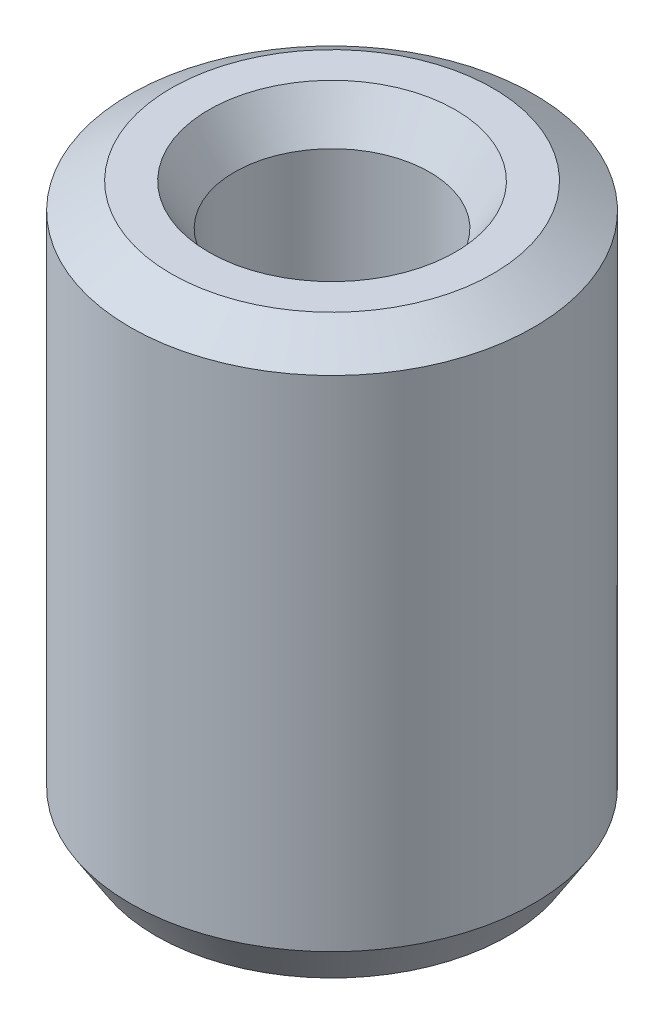
from build123d import *
from OCP.BRepFilletAPI import BRepFilletAPI_MakeChamfer

# Parameters (mm, degrees)
SKETCH1_R           = 5
BOSS_EXTRUDE1_DEPTH = 14.014862724
SKETCH2_R           = 2.415767301
CUT_EXTRUDE1_DEPTH  = 16.697655149
CHAMFER1_SIZE       = 0.638908955
CHAMFER1_SIZE2      = 1.016032577


with BuildPart() as part:
    # Sketch1 → Boss-Extrude1 (new body)
    with BuildSketch(Plane(origin=(0, 0, 0), x_dir=(1, 0, 0), z_dir=(0, 1, 0))):
        Circle(SKETCH1_R)
    extrude(amount=BOSS_EXTRUDE1_DEPTH)

    # Sketch2 → Cut-Extrude1 (cut, through all)
    with BuildSketch(Plane(origin=(0, 0, 0), x_dir=(1, 0, 0), z_dir=(0, 1, 0))):
        Circle(SKETCH2_R)
    extrude(amount=CUT_EXTRUDE1_DEPTH, mode=Mode.SUBTRACT)

    # Chamfer1: one chamfer whose edges measure the first distance from different faces: ONE call of the kernel's chamfer builder (chamfer() names one face for all edges)
    chamfer1_edges_1 = [part.edges().sort_by_distance(p)[0] for p in [
        (-2.415767301, 14.014862724, 0),
    ]]
    chamfer1_side_1 = [part.faces().sort_by_distance(p)[0] for p in [
        (-4.858578644, 14.014862724, 0),
    ]]
    chamfer1_edges_2 = [part.edges().sort_by_distance(p)[0] for p in [
        (-2.415767301, 0, 0),
    ]]
    chamfer1_side_2 = [part.faces().sort_by_distance(p)[0] for p in [
        (-2.415767301, 7.007431362, 0),
    ]]
    chamfer1_edges_3 = [part.edges().sort_by_distance(p)[0] for p in [
        (-5, 0, 0),
    ]]
    chamfer1_side_3 = [part.faces().sort_by_distance(p)[0] for p in [
        (-4.858578644, 0, 0),
    ]]
    chamfer1_edges_4 = [part.edges().sort_by_distance(p)[0] for p in [
        (-5, 14.014862724, 0),
    ]]
    chamfer1_side_4 = [part.faces().sort_by_distance(p)[0] for p in [
        (-5, 7.007431362, 0),
    ]]
    chamfer1 = BRepFilletAPI_MakeChamfer(part.part.solid().wrapped)
    for e in chamfer1_edges_1:
        chamfer1.Add(CHAMFER1_SIZE, CHAMFER1_SIZE2, e.wrapped, chamfer1_side_1[0].wrapped)  # the first distance lies on this face
    for e in chamfer1_edges_2:
        chamfer1.Add(CHAMFER1_SIZE, CHAMFER1_SIZE2, e.wrapped, chamfer1_side_2[0].wrapped)  # the first distance lies on this face
    for e in chamfer1_edges_3:
        chamfer1.Add(CHAMFER1_SIZE, CHAMFER1_SIZE2, e.wrapped, chamfer1_side_3[0].wrapped)  # the first distance lies on this face
    for e in chamfer1_edges_4:
        chamfer1.Add(CHAMFER1_SIZE, CHAMFER1_SIZE2, e.wrapped, chamfer1_side_4[0].wrapped)  # the first distance lies on this face
    add(Compound.cast(chamfer1.Shape()), mode=Mode.REPLACE)


solid = part.part
